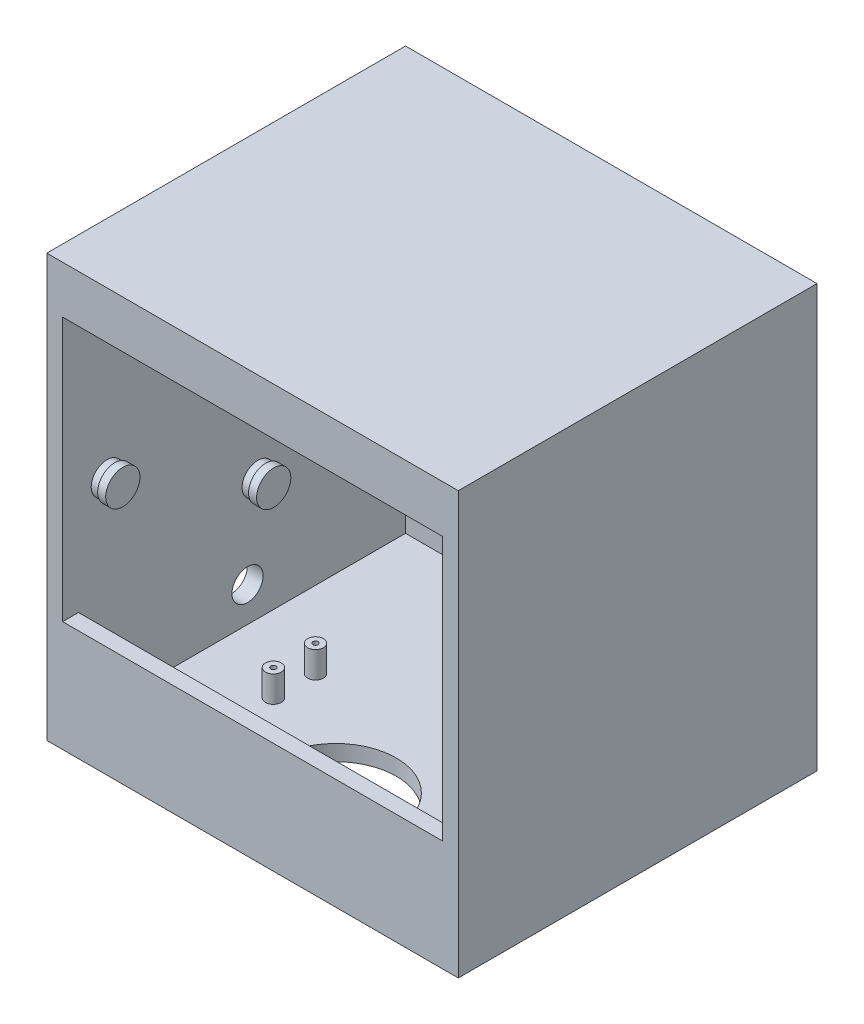
from build123d import *

# Parameters (mm, degrees)
BASE_PLATE_SKETCH_R   = 9.5
BASE_PLATE_SKETCH_R_2 = 3.175
BOSS_EXTRUDE2_DEPTH   = 31.75
BOSS_EXTRUDE2_2_DEPTH = 31.75
BOSS_EXTRUDE2_3_DEPTH = 31.75
BOSS_EXTRUDE2_4_DEPTH = 31.75
SKETCH1_5_W           = 495.3
SKETCH1_5_H           = 431.8
BOSS_EXTRUDE3_DEPTH   = 19.05
SKETCH1_6_R           = 73.025
SKETCH1_6_R_2         = 4.1
CUT_EXTRUDE1_DEPTH    = 99.05
SKETCH1_7_W           = 495.3
SKETCH1_7_H           = 431.8
SKETCH1_7_W_2         = 457.2
SKETCH1_7_H_2         = 393.7
BOSS_EXTRUDE4_DEPTH   = 469.9
BACK_WALL_SKETCH_W    = 457.2
BACK_WALL_SKETCH_H    = 152.4
BOSS_EXTRUDE5_DEPTH   = 38.3
BACK_WALL_SKETCH_5_W  = 457.2
BACK_WALL_SKETCH_5_H  = 152.4
CUT_EXTRUDE2_DEPTH    = 19.25
BACK_WALL_SKETCH_7_R  = 16.8
CUT_EXTRUDE5_DEPTH    = 28.875
BACK_WALL_SKETCH_8_R  = 1.875
CUT_EXTRUDE6_DEPTH    = 28.875
LEFT_WALL_SKETCH_R    = 18.75
CUT_EXTRUDE7_DEPTH    = 28.875
LEFT_WALL_SKETCH_3_R  = 19
BOSS_EXTRUDE6_DEPTH   = 9.349994
SKETCH5_R             = 20.6
BOSS_EXTRUDE7_DEPTH   = 9.7
CHAMBER_DOOR_SKETCH_W = 457.2
CHAMBER_DOOR_SKETCH_H = 317.5
CUT_EXTRUDE8_DEPTH    = 25.4
TOP_SKETCH_W          = 495.3
TOP_SKETCH_H          = 431.8
BOSS_EXTRUDE8_DEPTH   = 19.05
BOSS_EXTRUDE9_DEPTH   = 12.7


with BuildPart() as part:
    # Base Plate Sketch → Boss-Extrude2 (new body)
    with BuildSketch(Plane(origin=(0, 0, 0), x_dir=(1, 0, 0), z_dir=(0, 1, 0))):
        with Locations((-84.82915121, 32.220033819)):
            Circle(BASE_PLATE_SKETCH_R)
        with Locations((-84.82915121, 32.220033819)):
            Circle(BASE_PLATE_SKETCH_R_2, mode=Mode.SUBTRACT)
    extrude(amount=BOSS_EXTRUDE2_DEPTH)



with BuildPart() as body_2:
    # Base Plate Sketch → Boss-Extrude2 2 (new body)
    with BuildSketch(Plane(origin=(0, 0, 0), x_dir=(1, 0, 0), z_dir=(0, 1, 0))):
        with Locations((-84.82915121, -18.529928181)):
            Circle(BASE_PLATE_SKETCH_R)
        with Locations((-84.82915121, -18.529928181)):
            Circle(BASE_PLATE_SKETCH_R_2, mode=Mode.SUBTRACT)
    extrude(amount=BOSS_EXTRUDE2_2_DEPTH)


with BuildPart() as body_3:
    # Base Plate Sketch → Boss-Extrude2 3 (new body)
    with BuildSketch(Plane(origin=(0, 0, 0), x_dir=(1, 0, 0), z_dir=(0, 1, 0))):
        with Locations((188.22084879, -18.529928181)):
            Circle(BASE_PLATE_SKETCH_R)
        with Locations((188.22084879, -18.529928181)):
            Circle(BASE_PLATE_SKETCH_R_2, mode=Mode.SUBTRACT)
    extrude(amount=BOSS_EXTRUDE2_3_DEPTH)


with BuildPart() as body_4:
    # Base Plate Sketch → Boss-Extrude2 4 (new body)
    with BuildSketch(Plane(origin=(0, 0, 0), x_dir=(1, 0, 0), z_dir=(0, 1, 0))):
        with Locations((188.22084879, 32.220033819)):
            Circle(BASE_PLATE_SKETCH_R)
        with Locations((188.22084879, 32.220033819)):
            Circle(BASE_PLATE_SKETCH_R_2, mode=Mode.SUBTRACT)
    extrude(amount=BOSS_EXTRUDE2_4_DEPTH)


with BuildPart() as part_1:
    add(part.part)

    add(body_2.part)  # Boss-Extrude3 merges body 2

    add(body_3.part)  # Boss-Extrude3 merges body 3

    add(body_4.part)  # Boss-Extrude3 merges body 4
    # Sketch1<5> → Boss-Extrude3 (add)
    with BuildSketch(Plane(origin=(0, 0, 0), x_dir=(1, 0, 0), z_dir=(0, 1, 0))):
        with Locations((51.69584879, 35.795033019)):
            Rectangle(SKETCH1_5_W, SKETCH1_5_H)
    extrude(amount=-BOSS_EXTRUDE3_DEPTH)

    # Sketch1<6> → Cut-Extrude1 (cut)
    with BuildSketch(Plane(origin=(0, 0, 0), x_dir=(1, 0, 0), z_dir=(0, 1, 0))):
        with Locations((51.69584879, -80.092466981)):
            Circle(SKETCH1_6_R)
        with Locations((-72.12915121, -80.754975181)):
            Circle(SKETCH1_6_R_2)
        with Locations((-72.12915121, 203.670033819)):
            Circle(SKETCH1_6_R_2)
        with Locations((175.52084879, -80.754975181)):
            Circle(SKETCH1_6_R_2)
        with Locations((175.52084879, 203.670033819)):
            Circle(SKETCH1_6_R_2)
    extrude(amount=-CUT_EXTRUDE1_DEPTH, mode=Mode.SUBTRACT)

    # Sketch1<7> → Boss-Extrude4 (add)
    with BuildSketch(Plane(origin=(0, 0, 0), x_dir=(1, 0, 0), z_dir=(0, 1, 0))):
        with Locations((51.69584879, 35.795033019)):
            Rectangle(SKETCH1_7_W, SKETCH1_7_H)
        with Locations((51.69584879, 35.795033019)):
            Rectangle(SKETCH1_7_W_2, SKETCH1_7_H_2, mode=Mode.SUBTRACT)
    extrude(amount=BOSS_EXTRUDE4_DEPTH)

    # Back Wall Sketch → Boss-Extrude5 (add)
    with BuildSketch(Plane.XY.offset(-232.645033019)):
        with Locations((51.69584879, 190.5)):
            Rectangle(BACK_WALL_SKETCH_W, BACK_WALL_SKETCH_H)
    extrude(amount=-BOSS_EXTRUDE5_DEPTH)

    # Back Wall Sketch<5> → Cut-Extrude2 (cut)
    with BuildSketch(Plane.XY.offset(-232.645033019)):
        with Locations((51.69584879, 190.5)):
            Rectangle(BACK_WALL_SKETCH_5_W, BACK_WALL_SKETCH_5_H)
    extrude(amount=-CUT_EXTRUDE2_DEPTH, mode=Mode.SUBTRACT)


with BuildPart() as cut_extrude2_piece_1:
    # of the separate pieces the step leaves, piece 1, a body of its own (cut_extrude2_pieces)
    add(part_1.part.solids().sort_by_distance((-195.95415121, -19.05, -251.695033019))[0])

    # Back Wall Sketch<8> → Cut-Extrude6 (cut)
    with BuildSketch(Plane.XY.offset(-232.645033019)):
        with Locations((-117.971635681, 342.32499988)):
            Circle(BACK_WALL_SKETCH_8_R)
        with Locations((-21.04165115, 294.98749994)):
            Circle(BACK_WALL_SKETCH_8_R)
        with Locations((-117.971635681, 316.57499988)):
            Circle(BACK_WALL_SKETCH_8_R)
        with Locations((124.43334873, 294.98749994)):
            Circle(BACK_WALL_SKETCH_8_R)
        with Locations((221.363333262, 342.32499988)):
            Circle(BACK_WALL_SKETCH_8_R)
        with Locations((221.363333262, 316.57499988)):
            Circle(BACK_WALL_SKETCH_8_R)
    extrude(amount=-CUT_EXTRUDE6_DEPTH, mode=Mode.SUBTRACT)

    # Left Wall Sketch → Cut-Extrude7 (cut)
    with BuildSketch(Plane(origin=(-176.90415121, 0, 0), x_dir=(0, 0, -1), z_dir=(1, 0, 0))):
        with Locations((42.445032419, 41.6100006)):
            Circle(LEFT_WALL_SKETCH_R)
    extrude(amount=-CUT_EXTRUDE7_DEPTH, mode=Mode.SUBTRACT)

    # Left Wall Sketch<3> → Boss-Extrude6 (add)
    with BuildSketch(Plane(origin=(-176.90415121, 0, 0), x_dir=(0, 0, -1), z_dir=(1, 0, 0))):
        with Locations((-126.714166981, 237.439962)):
            Circle(LEFT_WALL_SKETCH_3_R)
        with Locations((54.895071019, 145.999962)):
            Circle(LEFT_WALL_SKETCH_3_R)
    extrude(amount=BOSS_EXTRUDE6_DEPTH)

    # Sketch5 → Boss-Extrude7 (add)
    with BuildSketch(Plane(origin=(-167.55415721, 0, 0), x_dir=(0, 0, -1), z_dir=(1, 0, 0))):
        with Locations((-126.714166981, 237.439962)):
            Circle(SKETCH5_R)
        with Locations((54.895071019, 145.999962)):
            Circle(SKETCH5_R)
    extrude(amount=BOSS_EXTRUDE7_DEPTH)

    # Chamber Door Sketch → Cut-Extrude8 (cut)
    with BuildSketch(Plane(origin=(0, 0, 161.054966981), x_dir=(-1, 0, 0), z_dir=(0, 0, -1))):
        with Locations((-51.69584879, 273.05)):
            Rectangle(CHAMBER_DOOR_SKETCH_W, CHAMBER_DOOR_SKETCH_H)
    extrude(amount=-CUT_EXTRUDE8_DEPTH, mode=Mode.SUBTRACT)

    # Top Sketch → Boss-Extrude8 (add)
    with BuildSketch(Plane(origin=(0, 469.9, 0), x_dir=(1, 0, 0), z_dir=(0, 1, 0))):
        with Locations((51.69584879, 35.795033019)):
            Rectangle(TOP_SKETCH_W, TOP_SKETCH_H)
    extrude(amount=BOSS_EXTRUDE8_DEPTH)

    # Sketch7 → Boss-Extrude9 (add)
    with BuildSketch(Plane.XZ.offset(-469.9)):
        Polygon((22.020139267, -181.825033019), (11.010069633, -162.755033019), (-11.010069633, -162.755033019), (-22.020139267, -181.825033019), (-11.010069633, -200.895033019), (11.010069633, -200.895033019), align=None)
    extrude(amount=BOSS_EXTRUDE9_DEPTH)


with BuildPart() as cut_extrude2_piece_2:
    # of the separate pieces the step leaves, piece 2, a body of its own (cut_extrude2_pieces)
    add(part_1.part.solids().sort_by_distance((-176.90415121, 114.3, -251.895033019))[0])

    # Back Wall Sketch<7> → Cut-Extrude5 (cut)
    with BuildSketch(Plane.XY.offset(-232.645033019)):
        with Locations((184.12128879, 148.2999955)):
            Circle(BACK_WALL_SKETCH_7_R)
    extrude(amount=-CUT_EXTRUDE5_DEPTH, mode=Mode.SUBTRACT)


solid = Compound([cut_extrude2_piece_1.part, cut_extrude2_piece_2.part])
